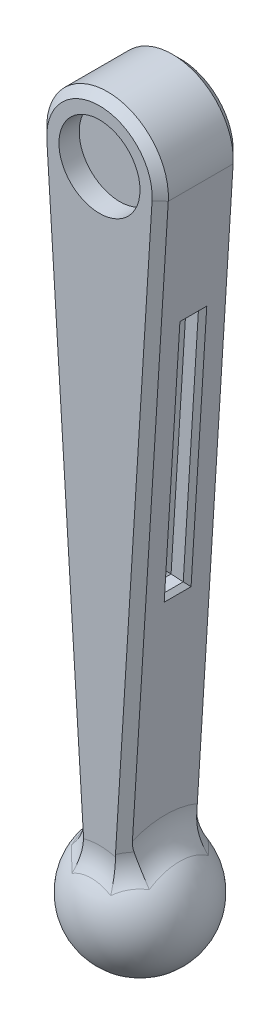
from build123d import *

# Parameters (mm, degrees)
BOSS_EXTRUDE1_DEPTH = 10
SKETCH2_R           = 10
CUT_EXTRUDE1_DEPTH  = 5
CHAMFER1_SIZE       = 2
FILLET1_R           = 10
SKETCH5_W           = 4.624562382
SKETCH5_H           = 60
CUT_EXTRUDE2_DEPTH  = 5
CHAMFER2_SIZE       = 1


with BuildPart() as part:
    # Sketch1 → Boss-Extrude1 (new, symmetric)
    with BuildSketch(Plane.XY):
        with BuildLine():
            Line((-14.970674459, -0.9375), (-4.99022482, -160.3125))
            ThreePointArc((-4.99022482, -160.3125), (0, -165), (4.99022482, -160.3125))
            Line((4.99022482, -160.3125), (14.970674459, -0.9375))
            ThreePointArc((14.970674459, -0.9375), (0, 15), (-14.970674459, -0.9375))
        make_face()
    extrude(amount=BOSS_EXTRUDE1_DEPTH, both=True)

    # Sketch2 → Cut-Extrude1 (cut)
    with BuildSketch(Plane.XY.offset(10)):
        Circle(SKETCH2_R)
    cut_extrude1 = extrude(amount=-CUT_EXTRUDE1_DEPTH, mode=Mode.SUBTRACT)

    # Mirror1: Cut-Extrude1 across plane
    add(cut_extrude1.mirror(Plane.XY), mode=Mode.SUBTRACT)

    # Sketch4 → Revolve1 (revolve)
    with BuildSketch(Plane.XY):
        with BuildLine():
            Line((0, -145), (0, -175))
            ThreePointArc((0, -175), (-15, -160), (0, -145))
        make_face()
    revolve(axis=Axis((0, -145, 0), (0, -1, 0)))

    # Chamfer1
    chamfer1_edges = [part.edges().sort_by_distance(p)[0] for p in [
        (10.292949639, -75.63477518, -10),
        (10.292949639, -75.63477518, 10),
        (0, 15, 10),
        (-10.292949639, -75.63477518, -10),
        (0, 15, -10),
        (-10.292949639, -75.63477518, 10),
    ]]
    chamfer(chamfer1_edges, length=CHAMFER1_SIZE)

    # Fillet1
    # the kernel refuses this fillet: 10 mm, written as the material it adds along each edge
    with BuildSketch(Plane(origin=(-4.99022482, -160.3125, 0), x_dir=(-0.06250000000000007, 0.998044963916957, 0), z_dir=(0, 0, 1))) as fillet1_piece_1_section:
        with BuildLine():
            CenterArc((20, 10), FILLET1_R, 216.869897646, 53.130102354)
            ThreePointArc((12, 4), (13.223192267, 2.081467804), (14.142135624, 0))
            Line((14.142135624, 0), (20, 0))
        make_face()
    fillet1_piece_1 = revolve(axis=Axis((-4.99022482, -160.3125, 0), (-0.9980449639169571, -0.0625000000000001, 0)), revolution_arc=93.785115708, mode=Mode.PRIVATE)
    fillet1_piece_1 = split(fillet1_piece_1, bisect_by=Plane(origin=(-8.411420692, -145.815593995, -5.491549314), z_dir=(0.7057243619147634, 0.04419417382415924, 0.7071067811865476)), keep=Keep.TOP, mode=Mode.PRIVATE)
    add(fillet1_piece_1)
    with BuildSketch(Plane(origin=(0, -160, -10), x_dir=(0.9277589286511917, 0.3731800775872058, 0), z_dir=(0.3731800775872058, -0.9277589286511917, 0))) as fillet1_piece_2_section:
        with BuildLine():
            CenterArc((15, -10), FILLET1_R, 90, 36.869897646)
            Line((15, 0), (11.180339887, 0))
            ThreePointArc((11.180339887, 0), (10.139602038, -1.053889384), (9, -2))
        make_face()
    fillet1_piece_2 = revolve(axis=Axis((0, -160, -10), (0, 0, 1)), revolution_arc=136.176249713, mode=Mode.PRIVATE)
    fillet1_piece_2 = split(fillet1_piece_2, bisect_by=Plane(origin=(-1.711528803, -148.391440275, -12.017352281), z_dir=(0.7057243619147634, 0.04419417382415924, 0.7071067811865476)), keep=Keep.TOP, mode=Mode.PRIVATE)
    fillet1_piece_2 = split(fillet1_piece_2, bisect_by=Plane(origin=(1.711528818, -148.391440274, -12.017352265), z_dir=(-0.7057243619147635, 0.04419417382415914, 0.7071067811865476)), keep=Keep.TOP, mode=Mode.PRIVATE)
    add(fillet1_piece_2)
    with BuildSketch(Plane(origin=(4.99022482, -160.3125, 0), x_dir=(-0.00413731999969642, -0.06606770223695776, -0.9978065650737866), z_dir=(-0.06236291031711149, -0.9958558172351702, 0.0661971199951418))) as fillet1_piece_3_section:
        with BuildLine():
            CenterArc((20, 10), FILLET1_R, 216.869897646, 53.130102354)
            Line((20, 0), (14.142135624, 0))
            ThreePointArc((14.142135624, 0), (13.223192267, 2.081467804), (12, 4))
        make_face()
    fillet1_piece_3 = revolve(axis=Axis((4.99022482, -160.3125, 0), (0.9980449639169571, -0.062499999999999827, 0)), revolution_arc=187.591182269, mode=Mode.PRIVATE)
    fillet1_piece_3 = split(fillet1_piece_3, bisect_by=Plane(origin=(10.264400578, -145.931631918, -3.6349397), z_dir=(-0.7057243619147635, 0.04419417382415914, 0.7071067811865476)), keep=Keep.TOP, mode=Mode.PRIVATE)
    fillet1_piece_3 = split(fillet1_piece_3, bisect_by=Plane(origin=(10.264400578, -145.931631918, 3.6349397), z_dir=(-0.7057243619147635, 0.04419417382415914, -0.7071067811865476)), keep=Keep.TOP, mode=Mode.PRIVATE)
    add(fillet1_piece_3)
    with BuildSketch(Plane(origin=(0, -160, 10), x_dir=(0.927758928651164, 0.3731800775872745, 0), z_dir=(0.3731800775872745, -0.927758928651164, 0))) as fillet1_piece_4_section:
        with BuildLine():
            CenterArc((15, 10), FILLET1_R, 233.130102354, 36.869897646)
            Line((15, 0), (11.180339887, 0))
            ThreePointArc((11.180339887, 0), (10.139602038, 1.053889384), (9, 2))
        make_face()
    fillet1_piece_4 = revolve(axis=Axis((0, -160, 10), (0, 0, 1)), revolution_arc=136.176249714, mode=Mode.PRIVATE)
    fillet1_piece_4 = split(fillet1_piece_4, bisect_by=Plane(origin=(-1.711528803, -148.391440275, 12.017352281), z_dir=(0.7057243619147634, 0.04419417382415924, -0.7071067811865476)), keep=Keep.TOP, mode=Mode.PRIVATE)
    fillet1_piece_4 = split(fillet1_piece_4, bisect_by=Plane(origin=(1.711528818, -148.391440274, 12.017352265), z_dir=(-0.7057243619147635, 0.04419417382415914, -0.7071067811865476)), keep=Keep.TOP, mode=Mode.PRIVATE)
    add(fillet1_piece_4)
    with BuildSketch(Plane(origin=(-6.487292265, -160.40625, -6.5), x_dir=(0.6656688251347166, 0.30034358438284603, -0.6831388925861491), z_dir=(0.24256574416798043, -0.9528066993467584, -0.1825411006764494))) as fillet1_piece_5_section:
        with BuildLine():
            CenterArc((16.020369437, -10), FILLET1_R, 90, 39.852602267)
            ThreePointArc((9.612221662, -2.323044738), (10.795413975, -1.221978705), (11.853269591, 0))
            Line((11.853269591, 0), (16.020369437, 0))
        make_face()
    fillet1_piece_5 = revolve(axis=Axis((-6.487292265, -160.40625, -6.5), (0.7057243619147634, 0.04419417382415923, 0.7071067811865476)), revolution_arc=115.087423951, mode=Mode.PRIVATE)
    fillet1_piece_5 = split(fillet1_piece_5, bisect_by=Plane(origin=(-5.569597037, -151.060667617, -10.379630778), z_dir=(-0.9980449639169571, -0.0625000000000001, 0)), keep=Keep.TOP, mode=Mode.PRIVATE)
    fillet1_piece_5 = split(fillet1_piece_5, bisect_by=Plane(origin=(-5.941894243, -151.083981773, -10), z_dir=(0, 0, -1)), keep=Keep.TOP, mode=Mode.PRIVATE)
    add(fillet1_piece_5)
    with BuildSketch(Plane(origin=(-6.487292265, -160.40625, -6.5), x_dir=(0.6656688251347166, 0.30034358438284603, -0.6831388925861491), z_dir=(0.24256574416798043, -0.9528066993467584, -0.1825411006764494))) as fillet1_piece_6_section:
        with BuildLine():
            CenterArc((16.020369437, -10), FILLET1_R, 90, 39.852602267)
            ThreePointArc((9.612221662, -2.323044738), (10.795413975, -1.221978705), (11.853269591, 0))
            Line((11.853269591, 0), (16.020369437, 0))
        make_face()
    fillet1_piece_6 = revolve(axis=Axis((-6.487292265, -160.40625, -6.5), (0.7057243619147634, 0.04419417382415923, 0.7071067811865476)), revolution_arc=115.087423951, mode=Mode.PRIVATE)
    fillet1_piece_6 = split(fillet1_piece_6, bisect_by=Plane(origin=(-5.772117496, -147.826675231, -9.126693525), z_dir=(0.9980449639169571, 0.0625000000000001, 0)), keep=Keep.TOP, mode=Mode.PRIVATE)
    fillet1_piece_6 = split(fillet1_piece_6, bisect_by=Plane(origin=(-4.883304062, -147.771015575, -10), z_dir=(0, 0, 1)), keep=Keep.TOP, mode=Mode.PRIVATE)
    add(fillet1_piece_6)
    with BuildSketch(Plane(origin=(6.487292265, -160.40625, -6.5), x_dir=(-0.6656688251347197, 0.30034358438283354, -0.6831388925861517), z_dir=(-0.2425657441679716, -0.9528066993467625, -0.18254110067644053))) as fillet1_piece_7_section:
        with BuildLine():
            CenterArc((16.020369437, 10), FILLET1_R, 230.147397733, 39.852602267)
            Line((16.020369437, 0), (11.853269591, 0))
            ThreePointArc((11.853269591, 0), (10.795413975, 1.221978705), (9.612221662, 2.323044738))
        make_face()
    fillet1_piece_7 = revolve(axis=Axis((6.487292265, -160.40625, -6.5), (0.7057243619147635, -0.04419417382415914, -0.7071067811865476)), revolution_arc=115.087423951, mode=Mode.PRIVATE)
    fillet1_piece_7 = split(fillet1_piece_7, bisect_by=Plane(origin=(5.772117495, -147.826675244, -9.126693294), z_dir=(-0.9980449639169571, 0.062499999999999827, 0)), keep=Keep.TOP, mode=Mode.PRIVATE)
    fillet1_piece_7 = split(fillet1_piece_7, bisect_by=Plane(origin=(4.883304233, -147.771015598, -10), z_dir=(0, 0, 1)), keep=Keep.TOP, mode=Mode.PRIVATE)
    add(fillet1_piece_7)
    with BuildSketch(Plane(origin=(6.487292265, -160.40625, -6.5), x_dir=(-0.6656688251347197, 0.30034358438283354, -0.6831388925861517), z_dir=(-0.2425657441679716, -0.9528066993467625, -0.18254110067644053))) as fillet1_piece_8_section:
        with BuildLine():
            CenterArc((16.020369437, 10), FILLET1_R, 230.147397733, 39.852602267)
            Line((16.020369437, 0), (11.853269591, 0))
            ThreePointArc((11.853269591, 0), (10.795413975, 1.221978705), (9.612221662, 2.323044738))
        make_face()
    fillet1_piece_8 = revolve(axis=Axis((6.487292265, -160.40625, -6.5), (0.7057243619147635, -0.04419417382415914, -0.7071067811865476)), revolution_arc=115.087423951, mode=Mode.PRIVATE)
    fillet1_piece_8 = split(fillet1_piece_8, bisect_by=Plane(origin=(5.569597038, -151.060667609, -10.379630783), z_dir=(0.9980449639169571, -0.062499999999999827, 0)), keep=Keep.TOP, mode=Mode.PRIVATE)
    fillet1_piece_8 = split(fillet1_piece_8, bisect_by=Plane(origin=(5.941894234, -151.083981764, -10), z_dir=(0, 0, -1)), keep=Keep.TOP, mode=Mode.PRIVATE)
    add(fillet1_piece_8)
    with BuildSketch(Plane(origin=(-6.487292265, -160.40625, 6.5), x_dir=(0.6656688251347166, 0.3003435843828461, 0.6831388925861492), z_dir=(0.24256574416798046, -0.9528066993467585, 0.18254110067644944))) as fillet1_piece_9_section:
        with BuildLine():
            CenterArc((16.020369437, 10), FILLET1_R, 230.147397733, 39.852602267)
            ThreePointArc((9.612221662, 2.323044738), (10.795413975, 1.221978705), (11.853269591, 0))
            Line((11.853269591, 0), (16.020369437, 0))
        make_face()
    fillet1_piece_9 = revolve(axis=Axis((-6.487292265, -160.40625, 6.5), (-0.7057243619147634, -0.04419417382415923, 0.7071067811865476)), revolution_arc=115.087423951, mode=Mode.PRIVATE)
    fillet1_piece_9 = split(fillet1_piece_9, bisect_by=Plane(origin=(-5.569597037, -151.060667617, 10.379630778), z_dir=(-0.9980449639169571, -0.0625000000000001, 0)), keep=Keep.TOP, mode=Mode.PRIVATE)
    fillet1_piece_9 = split(fillet1_piece_9, bisect_by=Plane(origin=(-5.941894243, -151.083981773, 10), z_dir=(0, 0, 1)), keep=Keep.TOP, mode=Mode.PRIVATE)
    add(fillet1_piece_9)
    with BuildSketch(Plane(origin=(-6.487292265, -160.40625, 6.5), x_dir=(0.6656688251347166, 0.3003435843828461, 0.6831388925861492), z_dir=(0.24256574416798046, -0.9528066993467585, 0.18254110067644944))) as fillet1_piece_10_section:
        with BuildLine():
            CenterArc((16.020369437, 10), FILLET1_R, 230.147397733, 39.852602267)
            ThreePointArc((9.612221662, 2.323044738), (10.795413975, 1.221978705), (11.853269591, 0))
            Line((11.853269591, 0), (16.020369437, 0))
        make_face()
    fillet1_piece_10 = revolve(axis=Axis((-6.487292265, -160.40625, 6.5), (-0.7057243619147634, -0.04419417382415923, 0.7071067811865476)), revolution_arc=115.087423951, mode=Mode.PRIVATE)
    fillet1_piece_10 = split(fillet1_piece_10, bisect_by=Plane(origin=(-5.772117496, -147.826675231, 9.126693525), z_dir=(0.9980449639169571, 0.0625000000000001, 0)), keep=Keep.TOP, mode=Mode.PRIVATE)
    fillet1_piece_10 = split(fillet1_piece_10, bisect_by=Plane(origin=(-4.883304062, -147.771015575, 10), z_dir=(0, 0, -1)), keep=Keep.TOP, mode=Mode.PRIVATE)
    add(fillet1_piece_10)
    with BuildSketch(Plane(origin=(6.487292265, -160.40625, 6.5), x_dir=(-0.6656688251347211, 0.30034358438282877, 0.6831388925861526), z_dir=(-0.2425657441679683, -0.9528066993467641, 0.18254110067643708))) as fillet1_piece_11_section:
        with BuildLine():
            CenterArc((16.020369437, -10), FILLET1_R, 90, 39.852602267)
            Line((16.020369437, 0), (11.853269591, 0))
            ThreePointArc((11.853269591, 0), (10.795413975, -1.221978705), (9.612221662, -2.323044738))
        make_face()
    fillet1_piece_11 = revolve(axis=Axis((6.487292265, -160.40625, 6.5), (-0.7057243619147635, 0.04419417382415914, -0.7071067811865476)), revolution_arc=115.087423951, mode=Mode.PRIVATE)
    fillet1_piece_11 = split(fillet1_piece_11, bisect_by=Plane(origin=(5.772117495, -147.826675244, 9.126693294), z_dir=(-0.9980449639169571, 0.062499999999999827, 0)), keep=Keep.TOP, mode=Mode.PRIVATE)
    fillet1_piece_11 = split(fillet1_piece_11, bisect_by=Plane(origin=(4.883304233, -147.771015598, 10), z_dir=(0, 0, -1)), keep=Keep.TOP, mode=Mode.PRIVATE)
    add(fillet1_piece_11)
    with BuildSketch(Plane(origin=(6.487292265, -160.40625, 6.5), x_dir=(-0.6656688251347211, 0.30034358438282877, 0.6831388925861526), z_dir=(-0.2425657441679683, -0.9528066993467641, 0.18254110067643708))) as fillet1_piece_12_section:
        with BuildLine():
            CenterArc((16.020369437, -10), FILLET1_R, 90, 39.852602267)
            Line((16.020369437, 0), (11.853269591, 0))
            ThreePointArc((11.853269591, 0), (10.795413975, -1.221978705), (9.612221662, -2.323044738))
        make_face()
    fillet1_piece_12 = revolve(axis=Axis((6.487292265, -160.40625, 6.5), (-0.7057243619147635, 0.04419417382415914, -0.7071067811865476)), revolution_arc=115.087423951, mode=Mode.PRIVATE)
    fillet1_piece_12 = split(fillet1_piece_12, bisect_by=Plane(origin=(5.569597038, -151.060667609, 10.379630783), z_dir=(0.9980449639169571, -0.062499999999999827, 0)), keep=Keep.TOP, mode=Mode.PRIVATE)
    fillet1_piece_12 = split(fillet1_piece_12, bisect_by=Plane(origin=(5.941894234, -151.083981764, 10), z_dir=(0, 0, 1)), keep=Keep.TOP, mode=Mode.PRIVATE)
    add(fillet1_piece_12)
    with BuildSketch(Plane(origin=(-4.99022482, -160.3125, 0), x_dir=(0.004125917934225977, -0.06588562585262338, 0.9978186514127746), z_dir=(0.06236366571329851, -0.9958678799449294, -0.06601468694761675))) as fillet1_piece_13_section:
        with BuildLine():
            CenterArc((20, 10), FILLET1_R, 216.869897646, 53.130102354)
            ThreePointArc((12, 4), (13.223192267, 2.081467804), (14.142135624, 0))
            Line((14.142135624, 0), (20, 0))
        make_face()
    fillet1_piece_13 = revolve(axis=Axis((-4.99022482, -160.3125, 0), (-0.9980449639169571, -0.0625000000000001, 0)), revolution_arc=93.785115567, mode=Mode.PRIVATE)
    fillet1_piece_13 = split(fillet1_piece_13, bisect_by=Plane(origin=(-8.411420714, -145.815594602, 5.491549255), z_dir=(0.7057243619147634, 0.04419417382415924, -0.7071067811865476)), keep=Keep.TOP, mode=Mode.PRIVATE)
    add(fillet1_piece_13)
    with BuildSketch(Plane(origin=(-4.99022482, -160.3125, 0), x_dir=(-0.06250000000000007, 0.998044963916957, 0), z_dir=(0, 0, 1))) as fillet1_piece_14a_section:
        with BuildLine():
            CenterArc((20, 10), FILLET1_R, 216.869897646, 53.130102354)
            ThreePointArc((12, 4), (13.223192267, 2.081467804), (14.142135624, 0))
            Line((14.142135624, 0), (20, 0))
        make_face()
    fillet1_piece_14a = revolve(axis=Axis((-4.99022482, -160.3125, 0), (-0.9980449639169571, -0.0625000000000001, 0)), revolution_arc=93.785115708, mode=Mode.PRIVATE)
    fillet1_piece_14a = split(fillet1_piece_14a, bisect_by=Plane(origin=(-3.494211706, -153.151927432, -9.94062414), z_dir=(-0.7057243619147634, -0.04419417382415924, -0.7071067811865476)), keep=Keep.TOP, mode=Mode.PRIVATE)
    with BuildSketch(Plane(origin=(-6.487292265, -160.40625, -6.5), x_dir=(0.6656688251347166, 0.30034358438284603, -0.6831388925861491), z_dir=(0.24256574416798043, -0.9528066993467584, -0.1825411006764494))) as fillet1_piece_14b_section:
        with BuildLine():
            CenterArc((16.020369437, -10), FILLET1_R, 90, 39.852602267)
            ThreePointArc((9.612221662, -2.323044738), (10.795413975, -1.221978705), (11.853269591, 0))
            Line((11.853269591, 0), (16.020369437, 0))
        make_face()
    fillet1_piece_14b = revolve(axis=Axis((-6.487292265, -160.40625, -6.5), (0.7057243619147634, 0.04419417382415923, 0.7071067811865476)), revolution_arc=115.087423951, mode=Mode.PRIVATE)
    fillet1_piece_14b = split(fillet1_piece_14b, bisect_by=Plane(origin=(-5.721423334, -148.636196083, -4.719931776), z_dir=(-0.9980449639169571, -0.0625000000000001, 0)), keep=Keep.TOP, mode=Mode.PRIVATE)
    fillet1_piece_14b = split(fillet1_piece_14b, bisect_by=Plane(origin=(-9.630722553, -148.881005896, -10), z_dir=(0, 0, 1)), keep=Keep.TOP, mode=Mode.PRIVATE)
    fillet1_piece_14 = fillet1_piece_14a & fillet1_piece_14b
    add(fillet1_piece_14)
    with BuildSketch(Plane(origin=(0, -160, -10), x_dir=(0.9277589286511917, 0.3731800775872058, 0), z_dir=(0.3731800775872058, -0.9277589286511917, 0))) as fillet1_piece_15a_section:
        with BuildLine():
            CenterArc((15, -10), FILLET1_R, 90, 36.869897646)
            Line((15, 0), (11.180339887, 0))
            ThreePointArc((11.180339887, 0), (10.139602038, -1.053889384), (9, -2))
        make_face()
    fillet1_piece_15a = revolve(axis=Axis((0, -160, -10), (0, 0, 1)), revolution_arc=136.176249713, mode=Mode.PRIVATE)
    fillet1_piece_15a = split(fillet1_piece_15a, bisect_by=Plane(origin=(5.440490375, -151.409548599, -8.107049193), z_dir=(0.7057243619147635, -0.04419417382415914, -0.7071067811865476)), keep=Keep.TOP, mode=Mode.PRIVATE)
    with BuildSketch(Plane(origin=(6.487292265, -160.40625, -6.5), x_dir=(-0.6656688251347197, 0.30034358438283354, -0.6831388925861517), z_dir=(-0.2425657441679716, -0.9528066993467625, -0.18254110067644053))) as fillet1_piece_15b_section:
        with BuildLine():
            CenterArc((16.020369437, 10), FILLET1_R, 230.147397733, 39.852602267)
            Line((16.020369437, 0), (11.853269591, 0))
            ThreePointArc((11.853269591, 0), (10.795413975, 1.221978705), (9.612221662, 2.323044738))
        make_face()
    fillet1_piece_15b = revolve(axis=Axis((6.487292265, -160.40625, -6.5), (0.7057243619147635, -0.04419417382415914, -0.7071067811865476)), revolution_arc=115.087423951, mode=Mode.PRIVATE)
    fillet1_piece_15b = split(fillet1_piece_15b, bisect_by=Plane(origin=(5.496353654, -152.230270657, -13.19776536), z_dir=(-0.9980449639169571, 0.062499999999999827, 0)), keep=Keep.TOP, mode=Mode.PRIVATE)
    fillet1_piece_15b = split(fillet1_piece_15b, bisect_by=Plane(origin=(0.892229328, -151.941949208, -10), z_dir=(0, 0, -1)), keep=Keep.TOP, mode=Mode.PRIVATE)
    fillet1_piece_15 = fillet1_piece_15a & fillet1_piece_15b
    add(fillet1_piece_15)
    with BuildSketch(Plane(origin=(-6.487292265, -160.40625, -6.5), x_dir=(0.6656688251347166, 0.30034358438284603, -0.6831388925861491), z_dir=(0.24256574416798043, -0.9528066993467584, -0.1825411006764494))) as fillet1_piece_16a_section:
        with BuildLine():
            CenterArc((16.020369437, -10), FILLET1_R, 90, 39.852602267)
            ThreePointArc((9.612221662, -2.323044738), (10.795413975, -1.221978705), (11.853269591, 0))
            Line((11.853269591, 0), (16.020369437, 0))
        make_face()
    fillet1_piece_16a = revolve(axis=Axis((-6.487292265, -160.40625, -6.5), (0.7057243619147634, 0.04419417382415923, 0.7071067811865476)), revolution_arc=115.087423951, mode=Mode.PRIVATE)
    fillet1_piece_16a = split(fillet1_piece_16a, bisect_by=Plane(origin=(-5.496353661, -152.230270541, -13.197765287), z_dir=(0.9980449639169571, 0.0625000000000001, 0)), keep=Keep.TOP, mode=Mode.PRIVATE)
    fillet1_piece_16a = split(fillet1_piece_16a, bisect_by=Plane(origin=(-0.892229413, -151.941949097, -10), z_dir=(0, 0, -1)), keep=Keep.TOP, mode=Mode.PRIVATE)
    with BuildSketch(Plane(origin=(0, -160, -10), x_dir=(0.9277589286511917, 0.3731800775872058, 0), z_dir=(0.3731800775872058, -0.9277589286511917, 0))) as fillet1_piece_16b_section:
        with BuildLine():
            CenterArc((15, -10), FILLET1_R, 90, 36.869897646)
            Line((15, 0), (11.180339887, 0))
            ThreePointArc((11.180339887, 0), (10.139602038, -1.053889384), (9, -2))
        make_face()
    fillet1_piece_16b = revolve(axis=Axis((0, -160, -10), (0, 0, 1)), revolution_arc=136.176249713, mode=Mode.PRIVATE)
    fillet1_piece_16b = split(fillet1_piece_16b, bisect_by=Plane(origin=(-5.440489805, -151.409549259, -8.10704972), z_dir=(-0.7057243619147634, -0.04419417382415924, -0.7071067811865476)), keep=Keep.TOP, mode=Mode.PRIVATE)
    fillet1_piece_16 = fillet1_piece_16a & fillet1_piece_16b
    add(fillet1_piece_16)
    with BuildSketch(Plane(origin=(6.487292265, -160.40625, -6.5), x_dir=(-0.6656688251347197, 0.30034358438283354, -0.6831388925861517), z_dir=(-0.2425657441679716, -0.9528066993467625, -0.18254110067644053))) as fillet1_piece_17a_section:
        with BuildLine():
            CenterArc((16.020369437, 10), FILLET1_R, 230.147397733, 39.852602267)
            Line((16.020369437, 0), (11.853269591, 0))
            ThreePointArc((11.853269591, 0), (10.795413975, 1.221978705), (9.612221662, 2.323044738))
        make_face()
    fillet1_piece_17a = revolve(axis=Axis((6.487292265, -160.40625, -6.5), (0.7057243619147635, -0.04419417382415914, -0.7071067811865476)), revolution_arc=115.087423951, mode=Mode.PRIVATE)
    fillet1_piece_17a = split(fillet1_piece_17a, bisect_by=Plane(origin=(5.721423339, -148.636196009, -4.719932198), z_dir=(0.9980449639169571, -0.062499999999999827, 0)), keep=Keep.TOP, mode=Mode.PRIVATE)
    fillet1_piece_17a = split(fillet1_piece_17a, bisect_by=Plane(origin=(9.630722077, -148.881005792, -10), z_dir=(0, 0, 1)), keep=Keep.TOP, mode=Mode.PRIVATE)
    with BuildSketch(Plane(origin=(4.99022482, -160.3125, 0), x_dir=(-0.00413731999969642, -0.06606770223695776, -0.9978065650737866), z_dir=(-0.06236291031711149, -0.9958558172351702, 0.0661971199951418))) as fillet1_piece_17b_section:
        with BuildLine():
            CenterArc((20, 10), FILLET1_R, 216.869897646, 53.130102354)
            Line((20, 0), (14.142135624, 0))
            ThreePointArc((14.142135624, 0), (13.223192267, 2.081467804), (12, 4))
        make_face()
    fillet1_piece_17b = revolve(axis=Axis((4.99022482, -160.3125, 0), (0.9980449639169571, -0.062499999999999827, 0)), revolution_arc=187.591182269, mode=Mode.PRIVATE)
    fillet1_piece_17b = split(fillet1_piece_17b, bisect_by=Plane(origin=(3.493920459, -153.153199191, -9.940835332), z_dir=(0.7057243619147635, -0.04419417382415914, -0.7071067811865476)), keep=Keep.TOP, mode=Mode.PRIVATE)
    fillet1_piece_17 = fillet1_piece_17a & fillet1_piece_17b
    add(fillet1_piece_17)
    with BuildSketch(Plane(origin=(4.99022482, -160.3125, 0), x_dir=(-0.00413731999969642, -0.06606770223695776, -0.9978065650737866), z_dir=(-0.06236291031711149, -0.9958558172351702, 0.0661971199951418))) as fillet1_piece_18a_section:
        with BuildLine():
            CenterArc((20, 10), FILLET1_R, 216.869897646, 53.130102354)
            Line((20, 0), (14.142135624, 0))
            ThreePointArc((14.142135624, 0), (13.223192267, 2.081467804), (12, 4))
        make_face()
    fillet1_piece_18a = revolve(axis=Axis((4.99022482, -160.3125, 0), (0.9980449639169571, -0.062499999999999827, 0)), revolution_arc=187.591182269, mode=Mode.PRIVATE)
    fillet1_piece_18a = split(fillet1_piece_18a, bisect_by=Plane(origin=(3.493920905, -153.153199702, 9.940834855), z_dir=(0.7057243619147635, -0.04419417382415914, 0.7071067811865476)), keep=Keep.TOP, mode=Mode.PRIVATE)
    with BuildSketch(Plane(origin=(6.487292265, -160.40625, 6.5), x_dir=(-0.6656688251347211, 0.30034358438282877, 0.6831388925861526), z_dir=(-0.2425657441679683, -0.9528066993467641, 0.18254110067643708))) as fillet1_piece_18b_section:
        with BuildLine():
            CenterArc((16.020369437, -10), FILLET1_R, 90, 39.852602267)
            Line((16.020369437, 0), (11.853269591, 0))
            ThreePointArc((11.853269591, 0), (10.795413975, -1.221978705), (9.612221662, -2.323044738))
        make_face()
    fillet1_piece_18b = revolve(axis=Axis((6.487292265, -160.40625, 6.5), (-0.7057243619147635, 0.04419417382415914, -0.7071067811865476)), revolution_arc=115.087423951, mode=Mode.PRIVATE)
    fillet1_piece_18b = split(fillet1_piece_18b, bisect_by=Plane(origin=(5.721423339, -148.636196009, 4.719932198), z_dir=(0.9980449639169571, -0.062499999999999827, 0)), keep=Keep.TOP, mode=Mode.PRIVATE)
    fillet1_piece_18b = split(fillet1_piece_18b, bisect_by=Plane(origin=(9.630722077, -148.881005792, 10), z_dir=(0, 0, -1)), keep=Keep.TOP, mode=Mode.PRIVATE)
    fillet1_piece_18 = fillet1_piece_18a & fillet1_piece_18b
    add(fillet1_piece_18)
    with BuildSketch(Plane(origin=(6.487292265, -160.40625, 6.5), x_dir=(-0.6656688251347211, 0.30034358438282877, 0.6831388925861526), z_dir=(-0.2425657441679683, -0.9528066993467641, 0.18254110067643708))) as fillet1_piece_19a_section:
        with BuildLine():
            CenterArc((16.020369437, -10), FILLET1_R, 90, 39.852602267)
            Line((16.020369437, 0), (11.853269591, 0))
            ThreePointArc((11.853269591, 0), (10.795413975, -1.221978705), (9.612221662, -2.323044738))
        make_face()
    fillet1_piece_19a = revolve(axis=Axis((6.487292265, -160.40625, 6.5), (-0.7057243619147635, 0.04419417382415914, -0.7071067811865476)), revolution_arc=115.087423951, mode=Mode.PRIVATE)
    fillet1_piece_19a = split(fillet1_piece_19a, bisect_by=Plane(origin=(5.496353654, -152.230270657, 13.19776536), z_dir=(-0.9980449639169571, 0.062499999999999827, 0)), keep=Keep.TOP, mode=Mode.PRIVATE)
    fillet1_piece_19a = split(fillet1_piece_19a, bisect_by=Plane(origin=(0.892229328, -151.941949208, 10), z_dir=(0, 0, 1)), keep=Keep.TOP, mode=Mode.PRIVATE)
    with BuildSketch(Plane(origin=(0, -160, 10), x_dir=(0.927758928651164, 0.3731800775872745, 0), z_dir=(0.3731800775872745, -0.927758928651164, 0))) as fillet1_piece_19b_section:
        with BuildLine():
            CenterArc((15, 10), FILLET1_R, 233.130102354, 36.869897646)
            Line((15, 0), (11.180339887, 0))
            ThreePointArc((11.180339887, 0), (10.139602038, 1.053889384), (9, 2))
        make_face()
    fillet1_piece_19b = revolve(axis=Axis((0, -160, 10), (0, 0, 1)), revolution_arc=136.176249714, mode=Mode.PRIVATE)
    fillet1_piece_19b = split(fillet1_piece_19b, bisect_by=Plane(origin=(5.440490375, -151.409548599, 8.107049193), z_dir=(0.7057243619147635, -0.04419417382415914, 0.7071067811865476)), keep=Keep.TOP, mode=Mode.PRIVATE)
    fillet1_piece_19 = fillet1_piece_19a & fillet1_piece_19b
    add(fillet1_piece_19)
    with BuildSketch(Plane(origin=(-6.487292265, -160.40625, 6.5), x_dir=(0.6656688251347166, 0.3003435843828461, 0.6831388925861492), z_dir=(0.24256574416798046, -0.9528066993467585, 0.18254110067644944))) as fillet1_piece_20a_section:
        with BuildLine():
            CenterArc((16.020369437, 10), FILLET1_R, 230.147397733, 39.852602267)
            ThreePointArc((9.612221662, 2.323044738), (10.795413975, 1.221978705), (11.853269591, 0))
            Line((11.853269591, 0), (16.020369437, 0))
        make_face()
    fillet1_piece_20a = revolve(axis=Axis((-6.487292265, -160.40625, 6.5), (-0.7057243619147634, -0.04419417382415923, 0.7071067811865476)), revolution_arc=115.087423951, mode=Mode.PRIVATE)
    fillet1_piece_20a = split(fillet1_piece_20a, bisect_by=Plane(origin=(-5.496353661, -152.230270541, 13.197765287), z_dir=(0.9980449639169571, 0.0625000000000001, 0)), keep=Keep.TOP, mode=Mode.PRIVATE)
    fillet1_piece_20a = split(fillet1_piece_20a, bisect_by=Plane(origin=(-0.892229413, -151.941949097, 10), z_dir=(0, 0, 1)), keep=Keep.TOP, mode=Mode.PRIVATE)
    with BuildSketch(Plane(origin=(0, -160, 10), x_dir=(0.927758928651164, 0.3731800775872745, 0), z_dir=(0.3731800775872745, -0.927758928651164, 0))) as fillet1_piece_20b_section:
        with BuildLine():
            CenterArc((15, 10), FILLET1_R, 233.130102354, 36.869897646)
            Line((15, 0), (11.180339887, 0))
            ThreePointArc((11.180339887, 0), (10.139602038, 1.053889384), (9, 2))
        make_face()
    fillet1_piece_20b = revolve(axis=Axis((0, -160, 10), (0, 0, 1)), revolution_arc=136.176249714, mode=Mode.PRIVATE)
    fillet1_piece_20b = split(fillet1_piece_20b, bisect_by=Plane(origin=(-5.440489805, -151.409549259, 8.10704972), z_dir=(-0.7057243619147634, -0.04419417382415924, 0.7071067811865476)), keep=Keep.TOP, mode=Mode.PRIVATE)
    fillet1_piece_20 = fillet1_piece_20a & fillet1_piece_20b
    add(fillet1_piece_20)
    with BuildSketch(Plane(origin=(-4.99022482, -160.3125, 0), x_dir=(0.004125917934225977, -0.06588562585262338, 0.9978186514127746), z_dir=(0.06236366571329851, -0.9958678799449294, -0.06601468694761675))) as fillet1_piece_21a_section:
        with BuildLine():
            CenterArc((20, 10), FILLET1_R, 216.869897646, 53.130102354)
            ThreePointArc((12, 4), (13.223192267, 2.081467804), (14.142135624, 0))
            Line((14.142135624, 0), (20, 0))
        make_face()
    fillet1_piece_21a = revolve(axis=Axis((-4.99022482, -160.3125, 0), (-0.9980449639169571, -0.0625000000000001, 0)), revolution_arc=93.785115567, mode=Mode.PRIVATE)
    fillet1_piece_21a = split(fillet1_piece_21a, bisect_by=Plane(origin=(-3.494211293, -153.151926908, 9.940624585), z_dir=(-0.7057243619147634, -0.04419417382415924, 0.7071067811865476)), keep=Keep.TOP, mode=Mode.PRIVATE)
    with BuildSketch(Plane(origin=(-6.487292265, -160.40625, 6.5), x_dir=(0.6656688251347166, 0.3003435843828461, 0.6831388925861492), z_dir=(0.24256574416798046, -0.9528066993467585, 0.18254110067644944))) as fillet1_piece_21b_section:
        with BuildLine():
            CenterArc((16.020369437, 10), FILLET1_R, 230.147397733, 39.852602267)
            ThreePointArc((9.612221662, 2.323044738), (10.795413975, 1.221978705), (11.853269591, 0))
            Line((11.853269591, 0), (16.020369437, 0))
        make_face()
    fillet1_piece_21b = revolve(axis=Axis((-6.487292265, -160.40625, 6.5), (-0.7057243619147634, -0.04419417382415923, 0.7071067811865476)), revolution_arc=115.087423951, mode=Mode.PRIVATE)
    fillet1_piece_21b = split(fillet1_piece_21b, bisect_by=Plane(origin=(-5.721423334, -148.636196083, 4.719931776), z_dir=(-0.9980449639169571, -0.0625000000000001, 0)), keep=Keep.TOP, mode=Mode.PRIVATE)
    fillet1_piece_21b = split(fillet1_piece_21b, bisect_by=Plane(origin=(-9.630722553, -148.881005896, 10), z_dir=(0, 0, -1)), keep=Keep.TOP, mode=Mode.PRIVATE)
    fillet1_piece_21 = fillet1_piece_21a & fillet1_piece_21b
    add(fillet1_piece_21)

    # Sketch5 → Cut-Extrude2 (cut)
    with BuildSketch(Plane(origin=(14.970674459, -0.9375, 0), x_dir=(0, 0, -1), z_dir=(0.9980449639169572, -0.06249999999999984, 0))):
        with Locations((0, -60)):
            Rectangle(SKETCH5_W, SKETCH5_H)
    extrude(amount=-CUT_EXTRUDE2_DEPTH, mode=Mode.SUBTRACT)

    # Chamfer2
    chamfer2_edges = [part.edges().sort_by_distance(p)[0] for p in [
        (6.230449639, -60.507697835, 2.312281191),
        (8.105449639, -30.566348918, 0),
        (6.230449639, -60.507697835, -2.312281191),
        (4.355449639, -90.449046753, 0),
        (11.220674459, -60.820197835, 2.312281191),
        (9.345674459, -90.761546753, 0),
        (11.220674459, -60.820197835, -2.312281191),
        (13.095674459, -30.878848918, 0),
    ]]
    chamfer(chamfer2_edges, length=CHAMFER2_SIZE)


with BuildPart() as body_2:
    # Mirror2: mirrored copy
    add(part.part.mirror(Plane.XY))


solid = body_2.part
